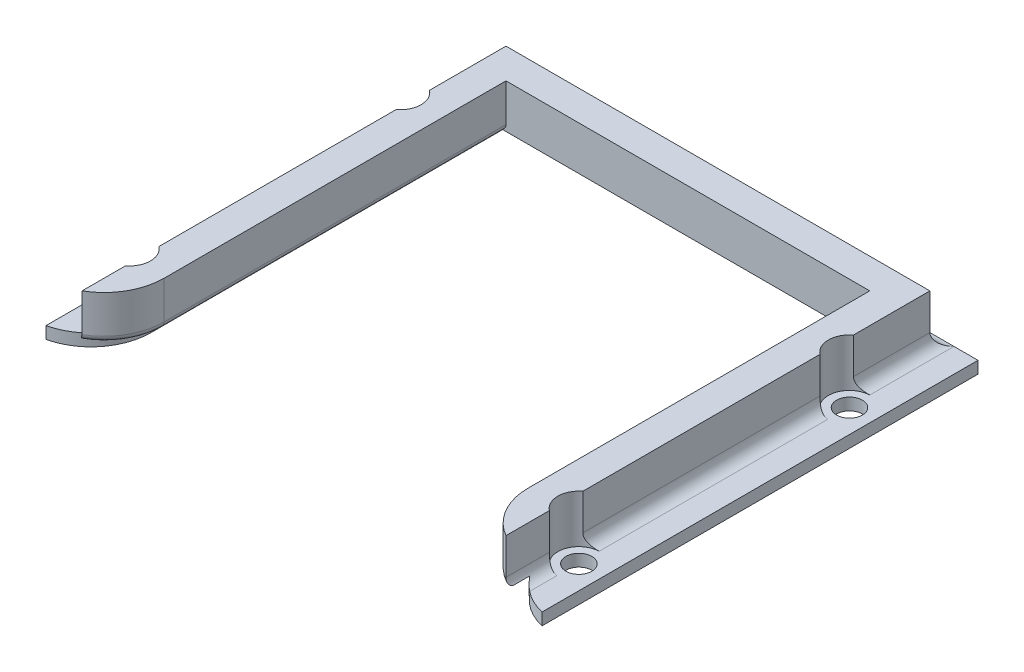
from build123d import *

# Parameters (mm, degrees)
SKETCH1_W           = 70.5
SKETCH1_H           = 70.5
SKETCH1_W_2         = 60.5
SKETCH1_H_2         = 60.5
BOSS_EXTRUDE1_DEPTH = 10
SKETCH2_W           = 67
SKETCH2_H           = 5.4
CUT_EXTRUDE1_DEPTH  = 70
BOSS_EXTRUDE3_DEPTH = 2
SKETCH7_W           = 60.5
SKETCH7_H           = 5
CUT_EXTRUDE3_DEPTH  = 25
FILLET2_R           = 2
SKETCH8_W           = 97.382964501
SKETCH8_H           = 35.083557697
CUT_EXTRUDE4_DEPTH  = 2
SKETCH9_R           = 2.15
CUT_EXTRUDE5_DEPTH  = 5
SKETCH10_R          = 3.5
CUT_EXTRUDE6_DEPTH  = 8
FILLET3_R           = 10
FILLET4_R           = 10
FILLET5_R           = 1


# Some blends are built 0.0001 mm under size
with BuildPart() as part:
    # Sketch1 → Boss-Extrude1 (new body)
    with BuildSketch(Plane(origin=(0, 0, 0), x_dir=(1, 0, 0), z_dir=(0, 1, 0))):
        Rectangle(SKETCH1_W, SKETCH1_H)
        Rectangle(SKETCH1_W_2, SKETCH1_H_2, mode=Mode.SUBTRACT)
    extrude(amount=BOSS_EXTRUDE1_DEPTH)

    # Sketch2 → Cut-Extrude1 (cut)
    with BuildSketch(Plane.XY.offset(35.25)):
        Rectangle(SKETCH2_W, SKETCH2_H)
    extrude(amount=-CUT_EXTRUDE1_DEPTH, mode=Mode.SUBTRACT)

    # Sketch6 → Boss-Extrude3 (add)
    with BuildSketch(Plane.XZ):
        Polygon((41.25, -37.25), (41.25, 37.25), (35.25, 37.25), (35.25, 35.25), (35.25, -35.25), (-35.25, -35.25), (-35.25, 35.25), (-35.25, 37.25), (-41.25, 37.25), (-41.25, -37.25), align=None)
    extrude(amount=-BOSS_EXTRUDE3_DEPTH)

    # Sketch7 → Cut-Extrude3 (cut)
    with BuildSketch(Plane.XZ.offset(-2.7)):
        with Locations((0, 32.75)):
            Rectangle(SKETCH7_W, SKETCH7_H)
    extrude(amount=-CUT_EXTRUDE3_DEPTH, mode=Mode.SUBTRACT)

    # Fillet2
    fillet2_edges = [part.edges().sort_by_distance(p)[0] for p in [
        (35.25, 2, 0),
        (-35.25, 2, 0),
        (0, 2, -35.25),
    ]]
    fillet(fillet2_edges, radius=FILLET2_R - 0.0001)  # a hair under: the kernel refuses the full size

    # Sketch8 → Cut-Extrude4 (cut)
    with BuildSketch(Plane.XY.offset(37.25)):
        with Locations((-5.820498703, 2.430952297)):
            Rectangle(SKETCH8_W, SKETCH8_H)
    extrude(amount=-CUT_EXTRUDE4_DEPTH, mode=Mode.SUBTRACT)

    # Sketch9 → Cut-Extrude5 (cut, symmetric)
    with BuildSketch(Plane.XZ):
        with Locations(Location((-37.375, 25.25, 0), (0, 0, 273.333029494))):
            Circle(SKETCH9_R)
        with Locations(Location((-37.375, -19.75, 0), (0, 0, 273.333029494))):
            Circle(SKETCH9_R)
        with Locations(Location((37.375, -19.75, 0), (0, 0, 266.666970506))):
            Circle(SKETCH9_R)
        with Locations(Location((37.375, 25.25, 0), (0, 0, 266.666970506))):
            Circle(SKETCH9_R)
    extrude(amount=CUT_EXTRUDE5_DEPTH, both=True, mode=Mode.SUBTRACT)

    # Sketch10 → Cut-Extrude6 (cut)
    with BuildSketch(Plane(origin=(0, 10, 0), x_dir=(1, 0, 0), z_dir=(0, 1, 0))):
        with Locations((-37.375, 19.75)):
            Circle(SKETCH10_R)
        with Locations((-37.375, -25.25)):
            Circle(SKETCH10_R)
        with Locations((37.375, -25.25)):
            Circle(SKETCH10_R)
        with Locations((37.375, 19.75)):
            Circle(SKETCH10_R)
    extrude(amount=-CUT_EXTRUDE6_DEPTH, mode=Mode.SUBTRACT)

    # Fillet3
    # the kernel refuses this fillet: 10 mm, written as the material it takes off along each edge
    with BuildSketch(Plane(origin=(-33.5, -24.358969087, 35.25), x_dir=(0, 0, -1), z_dir=(0, 1, 0)), Plane(origin=(33.5, 2.7, 35.25), x_dir=(0, 0, -1), z_dir=(0, -1, 0))) as fillet3_piece_1:
        with BuildLine():
            CenterArc((9.743587635, 10), FILLET3_R, 193.002878163, 76.997121837)
            Line((0, 7.75), (0, 0))
            Line((0, 0), (9.743587635, 0))
        make_face()
    extrude(amount=27.058969087, mode=Mode.SUBTRACT)

    # Fillet4
    # the kernel refuses this fillet: 10 mm, written as the material it takes off along each edge
    with BuildSketch(Plane(origin=(30.25, -18.950635095, 35.25), x_dir=(0, 0, -1), z_dir=(0, 1, 0))) as fillet4_piece_1:
        with BuildLine():
            CenterArc((8.660254038, -10), FILLET4_R, 90, 60)
            Line((0, -5), (-0.173205081, -4.9))
            ThreePointArc((-0.173205081, -4.9), (-0.2, -2.5), (-0.2, 0))
            Line((-0.2, 0), (0, 0.2))
            Line((0, 0.2), (8.660254038, 0.2))
            Line((8.660254038, 0.2), (8.660254038, 0))
        make_face()
    extrude(amount=50.601270189, mode=Mode.SUBTRACT)
    with BuildSketch(Plane(origin=(-30.25, -18.950635095, 35.25), x_dir=(0, 0, -1), z_dir=(0, 1, 0))) as fillet4_piece_2:
        with BuildLine():
            CenterArc((8.660254038, 10), FILLET4_R, 210, 60)
            Line((0, 5), (-0.173205081, 4.9))
            ThreePointArc((-0.173205081, 4.9), (-0.2, 2.5), (-0.2, 0))
            Line((-0.2, 0), (0, -0.2))
            Line((0, -0.2), (8.660254038, -0.2))
            Line((8.660254038, -0.2), (8.660254038, 0))
        make_face()
    extrude(amount=50.601270189, mode=Mode.SUBTRACT)

    # Fillet5
    # the kernel refuses this fillet: 1 mm, written as the material it takes off along each edge
    with BuildSketch(Plane(origin=(30.25, 2.7, 26.589745962), x_dir=(1, 0, 0), z_dir=(0, 0, -1)), Plane(origin=(-30.25, 2.7, -30.25), x_dir=(-1, 0, 0), z_dir=(0, 0, 1))) as fillet5_piece_1:
        with BuildLine():
            CenterArc((FILLET5_R, -FILLET5_R), FILLET5_R, 90, 90)
            Line((0, -FILLET5_R), (0, 0))
            Line((0, 0), (FILLET5_R, 0))
        make_face()
    extrude(amount=56.839745962, mode=Mode.SUBTRACT)
    with BuildSketch(Plane(origin=(40.25, 2.7, 26.589745962), x_dir=(-0.27015512952929444, 0, 0.9628168081151316), z_dir=(0.9628168081151316, 0, 0.27015512952929444))) as fillet5_piece_2:
        with BuildLine():
            CenterArc((10 - FILLET5_R, -FILLET5_R), FILLET5_R, 0, 90)
            Line((10 - FILLET5_R, 0), (10, 0))
            Line((10, 0), (10, -FILLET5_R))
        make_face()
    revolve(axis=Axis((40.25, 2.7, 26.589745962), (0, -1, 0)), revolution_arc=74.326501832, mode=Mode.SUBTRACT)
    with BuildSketch(Plane(origin=(-40.25, 2.7, 26.589745962), x_dir=(1, 0, 0), z_dir=(0, 0, -1))) as fillet5_piece_3:
        with BuildLine():
            CenterArc((10 - FILLET5_R, -FILLET5_R), FILLET5_R, 0, 90)
            Line((10, -FILLET5_R), (10, 0))
            Line((10, 0), (10 - FILLET5_R, 0))
        make_face()
    revolve(axis=Axis((-40.25, 2.7, 26.589745962), (0, -1, 0)), revolution_arc=74.326501832, mode=Mode.SUBTRACT)


solid = part.part
